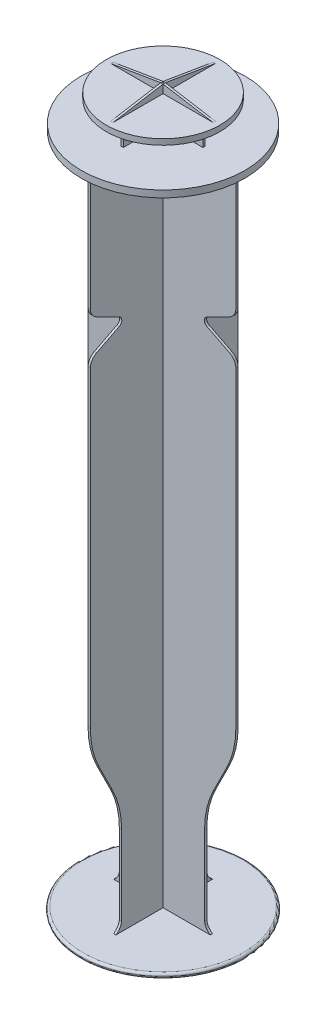
from build123d import *

# Parameters (mm, degrees)
EXTRUDE_START         = -0.2
EXTRUDE_1_OUTLINE_W   = 0.4
EXTRUDE_1_OUTLINE_H   = 3.7
EXTRUDE_1_DEPTH       = 0.4
EXTRUDE_START_2       = -7.2
EXTRUDE_1_2_OUTLINE_W = 0.4
EXTRUDE_1_2_OUTLINE_H = 3.7
EXTRUDE_1_2_DEPTH     = 7
EXTRUDE_START_3       = 119
EXTRUDE_1_3_OUTLINE_R = 14.4
EXTRUDE_1_3_DEPTH     = 1.2
EXTRUDE_1_4_OUTLINE_R = 14.5
EXTRUDE_1_4_DEPTH     = 0.85
EXTRUDE_START_4       = 123.9
EXTRUDE_1_5_OUTLINE_R = 10
EXTRUDE_1_5_DEPTH     = 1
EXTRUDE_1_6_DEPTH     = 0.4
CUT_EXTRUDE_1_DEPTH   = 129.075368436
CUT_EXTRUDE_2_DEPTH   = 129.075368436
DRAFT_1_ANGLE         = 63.434948823
DRAFT_2_ANGLE         = 63.434948823
RIB_1_REACH           = 130.053
SKETCH_4_WALL_W       = 267.026519706
SKETCH_4_WALL_H       = 0.4
RIB_2_REACH           = 130.053
SKETCH_5_WALL_W       = 267.026519706
SKETCH_5_WALL_H       = 0.4
RIB_3_REACH           = 130.053
SKETCH_6_WALL_W       = 267.026519706
SKETCH_6_WALL_H       = 0.4
RIB_4_REACH           = 130.053
SKETCH_7_WALL_W       = 261.805134662
SKETCH_7_WALL_H       = 0.4
RIB_5_REACH           = 130.053
SKETCH_8_WALL_W       = 261.805134662
SKETCH_8_WALL_H       = 0.4
RIB_6_REACH           = 130.053
SKETCH_9_WALL_W       = 261.805134662
SKETCH_9_WALL_H       = 0.4
RIB_START             = -0.2
RIB_7_DEPTH           = 0.4
RIB_8_DEPTH           = 0.4
FILLET_1_R            = 0.4
FILLET_2_R            = 2
FILLET_3_R            = 15


with BuildPart() as part:
    # 凸台-拉伸1: read off the stored shape, not the designer's step
    # 凸台-拉伸1 outline → 凸台-拉伸1 (new body)
    with BuildSketch(Plane.XY.offset(EXTRUDE_START)):
        Polygon((0, 126.4), (-0.2, 126.366666667), (-0.2, 124.9), (9, 124.9), (0.2, 126.366666667), align=None)
        with BuildLine():
            Line((13, 31), (13, 119))
            Line((13, 119), (-13, 119))
            Line((-13, 119), (-13, 20))
            Line((-13, 20), (-7.5, 20))
            Line((-7.5, 20), (-7.5, 2.391335203))
            ThreePointArc((-7.5, 2.391335203), (-7.838080215, 1.515615965), (-8.5, 0.85))
            Line((-8.5, 0.85), (8.5, 0.85))
            ThreePointArc((8.5, 0.85), (7.838080215, 1.515615965), (7.5, 2.391335203))
            Line((7.5, 2.391335203), (7.5, 31))
            Line((7.5, 31), (13, 31))
        make_face()
        with Locations((0, 122.05)):
            Rectangle(EXTRUDE_1_OUTLINE_W, EXTRUDE_1_OUTLINE_H)
    extrude(amount=EXTRUDE_1_DEPTH)

    # Extrude 1 2 outline → Extrude 1 2 (add)
    with BuildSketch(Plane.XY.offset(EXTRUDE_START_2)):
        with Locations((0, 122.05)):
            Rectangle(EXTRUDE_1_2_OUTLINE_W, EXTRUDE_1_2_OUTLINE_H)
    extrude(amount=EXTRUDE_1_2_DEPTH)

    # Extrude 1 3 outline → Extrude 1 3 (add)
    with BuildSketch(Plane(origin=(0, 0, 0), x_dir=(1, 0, 0), z_dir=(0, 1, 0)).offset(EXTRUDE_START_3)):
        Circle(EXTRUDE_1_3_OUTLINE_R)
    extrude(amount=EXTRUDE_1_3_DEPTH)

    # Extrude 1 4 outline → Extrude 1 4 (add)
    with BuildSketch(Plane(origin=(0, 0, 0), x_dir=(1, 0, 0), z_dir=(0, 1, 0))):
        Circle(EXTRUDE_1_4_OUTLINE_R)
    extrude(amount=EXTRUDE_1_4_DEPTH)

    # Extrude 1 5 outline → Extrude 1 5 (add)
    with BuildSketch(Plane(origin=(0, 0, 0), x_dir=(1, 0, 0), z_dir=(0, 1, 0)).offset(EXTRUDE_START_4)):
        Circle(EXTRUDE_1_5_OUTLINE_R)
    extrude(amount=EXTRUDE_1_5_DEPTH)

    # Extrude 1 6 outline → Extrude 1 6 (add)
    with BuildSketch(Plane.YZ.offset(EXTRUDE_START)):
        Polygon((126.366666667, -0.2), (126.4, 0), (126.366666667, 0.2), align=None)
    extrude(amount=EXTRUDE_1_6_DEPTH)

    # 草图2 → 切除-拉伸1 (cut, through all)
    with BuildSketch(Plane(origin=(0, 0, -0.2), x_dir=(-1, 0, 0), z_dir=(0, 0, -1))):
        with BuildLine():
            Line((-13, 90.7), (-7.905050667, 93.286666585))
            ThreePointArc((-7.905050667, 93.286666585), (-7.467204555, 94), (-7.905050667, 94.713333415))
            Line((-7.905050667, 94.713333415), (-13, 97.3))
            Line((-13, 97.3), (-13, 90.7))
        make_face()
    extrude(amount=-CUT_EXTRUDE_1_DEPTH, mode=Mode.SUBTRACT)

    # 草图3 → 切除-拉伸2 (cut, through all)
    with BuildSketch(Plane(origin=(0, 0, -0.2), x_dir=(-1, 0, 0), z_dir=(0, 0, -1))):
        with BuildLine():
            Line((13, 97.3), (7.905050667, 94.713333415))
            ThreePointArc((7.905050667, 94.713333415), (7.467204555, 94), (7.905050667, 93.286666585))
            Line((7.905050667, 93.286666585), (13, 90.7))
            Line((13, 90.7), (13, 97.3))
        make_face()
    extrude(amount=-CUT_EXTRUDE_2_DEPTH, mode=Mode.SUBTRACT)

    # 拔模1
    draft_1_faces = [part.faces().sort_by_distance(p)[0] for p in [
        (-10.25, 20, 0),
    ]]
    draft(draft_1_faces, Plane(origin=(-7.5, 0, -0.2), x_dir=(0, 0, -1), z_dir=(-1, 0, 0)), DRAFT_1_ANGLE)

    # 拔模2
    draft_2_faces = [part.faces().sort_by_distance(p)[0] for p in [
        (10.25, 31, 0),
    ]]
    draft(draft_2_faces, Plane(origin=(13, 0, 0.2), x_dir=(0, 0, 1), z_dir=(1, 0, 0)), DRAFT_2_ANGLE)

    # 草图4 wall → 筋1 (add, up to next)
    with BuildSketch(Plane(origin=(0, 125.633333334, 4.6), x_dir=(0, -0.164398987342, 0.986393923826), z_dir=(0, -0.986393923826, -0.164398987342)), mode=Mode.PRIVATE) as rib_1_sk1:
        Rectangle(SKETCH_4_WALL_W, SKETCH_4_WALL_H)
    rib_1_tool1 = extrude(rib_1_sk1.sketch, amount=RIB_1_REACH, mode=Mode.PRIVATE) - part.part
    add(rib_1_tool1.solids().sort_by_distance((0, 125.633333334, 4.6))[0])

    # 草图5 wall → 筋2 (add, up to next)
    with BuildSketch(Plane(origin=(-4.6, 125.633333334, 0), x_dir=(0.986393923826, 0.164398987342, 0), z_dir=(0.164398987342, -0.986393923826, 0)), mode=Mode.PRIVATE) as rib_2_sk1:
        Rectangle(SKETCH_5_WALL_W, SKETCH_5_WALL_H)
    rib_2_tool1 = extrude(rib_2_sk1.sketch, amount=RIB_2_REACH, mode=Mode.PRIVATE) - part.part
    add(rib_2_tool1.solids().sort_by_distance((-4.6, 125.633333334, 0))[0])

    # 草图6 wall → 筋3 (add, up to next)
    with BuildSketch(Plane(origin=(0, 125.633333334, -4.6), x_dir=(0, 0.164398987342, 0.986393923826), z_dir=(0, -0.986393923826, 0.164398987342)), mode=Mode.PRIVATE) as rib_3_sk1:
        Rectangle(SKETCH_6_WALL_W, SKETCH_6_WALL_H)
    rib_3_tool1 = extrude(rib_3_sk1.sketch, amount=RIB_3_REACH, mode=Mode.PRIVATE) - part.part
    add(rib_3_tool1.solids().sort_by_distance((0, 125.633333334, -4.6))[0])

    # 草图7 wall → 筋4 (add, up to next)
    with BuildSketch(Plane(origin=(-7.2, 122.05, 0), x_dir=(0, -1, 0), z_dir=(1, 0, 0)), mode=Mode.PRIVATE) as rib_4_sk1:
        Rectangle(SKETCH_7_WALL_W, SKETCH_7_WALL_H)
    rib_4_tool1 = extrude(rib_4_sk1.sketch, amount=RIB_4_REACH, mode=Mode.PRIVATE) - part.part
    add(rib_4_tool1.solids().sort_by_distance((-7.2, 122.05, 0))[0])

    # 草图8 wall → 筋5 (add, up to next)
    with BuildSketch(Plane(origin=(0, 122.05, 7.2), x_dir=(0, -1, 0), z_dir=(0, 0, -1)), mode=Mode.PRIVATE) as rib_5_sk1:
        Rectangle(SKETCH_8_WALL_W, SKETCH_8_WALL_H)
    rib_5_tool1 = extrude(rib_5_sk1.sketch, amount=RIB_5_REACH, mode=Mode.PRIVATE) - part.part
    add(rib_5_tool1.solids().sort_by_distance((0, 122.05, 7.2))[0])

    # 草图9 wall → 筋6 (add, up to next)
    with BuildSketch(Plane(origin=(7.2, 122.05, 0), x_dir=(0, -1, 0), z_dir=(-1, 0, 0)), mode=Mode.PRIVATE) as rib_6_sk1:
        Rectangle(SKETCH_9_WALL_W, SKETCH_9_WALL_H)
    rib_6_tool1 = extrude(rib_6_sk1.sketch, amount=RIB_6_REACH, mode=Mode.PRIVATE) - part.part
    add(rib_6_tool1.solids().sort_by_distance((7.2, 122.05, 0))[0])

    # 筋7: read off the stored shape, not the designer's step
    # 筋7 outline → 筋7 (add)
    with BuildSketch(Plane(origin=(0, 0, 0), x_dir=(0, 0, -1), z_dir=(1, 0, 0)).offset(RIB_START)):
        with BuildLine():
            Line((7.905050667, 94.713333415), (13, 97.3))
            Line((13, 97.3), (13, 119))
            Line((13, 119), (0.2, 119))
            Line((0.2, 119), (0.2, 0.85))
            Line((0.2, 0.85), (8.5, 0.85))
            ThreePointArc((8.5, 0.85), (7.838080215, 1.515615965), (7.5, 2.391335203))
            Line((7.5, 2.391335203), (7.5, 20))
            Line((7.5, 20), (13, 31))
            Line((13, 31), (13, 90.7))
            Line((13, 90.7), (7.905050667, 93.286666585))
            ThreePointArc((7.905050667, 93.286666585), (7.467204555, 94), (7.905050667, 94.713333415))
        make_face()
    extrude(amount=RIB_7_DEPTH)

    # 筋8: read off the stored shape, not the designer's step
    # 筋8 outline → 筋8 (add)
    with BuildSketch(Plane(origin=(0, 0, 0), x_dir=(0, -1, 0), z_dir=(-1, 0, 0)).offset(RIB_START)):
        with BuildLine():
            Line((-94.713333415, 7.905050667), (-97.3, 13))
            Line((-97.3, 13), (-119, 13))
            Line((-119, 13), (-119, 0.2))
            Line((-119, 0.2), (-0.85, 0.2))
            Line((-0.85, 0.2), (-0.85, 8.5))
            ThreePointArc((-0.85, 8.5), (-1.515615965, 7.838080215), (-2.391335203, 7.5))
            Line((-2.391335203, 7.5), (-20, 7.5))
            Line((-20, 7.5), (-31, 13))
            Line((-31, 13), (-90.7, 13))
            Line((-90.7, 13), (-93.286666585, 7.905050667))
            ThreePointArc((-93.286666585, 7.905050667), (-94, 7.467204555), (-94.713333415, 7.905050667))
        make_face()
    extrude(amount=RIB_8_DEPTH)

    # 圆角1
    fillet_1_edges = [part.edges().sort_by_distance(p)[0] for p in [
        (-14.5, 0, 0),
        (-14.5, 0.85, 0),
    ]]
    fillet(fillet_1_edges, radius=FILLET_1_R)

    # 圆角2
    fillet_2_edges = [part.edges().sort_by_distance(p)[0] for p in [
        (13, 90.7, 0),
        (13, 97.3, 0),
        (-13, 97.3, 0),
        (-13, 90.7, 0),
        (0, 90.7, -13),
        (0, 97.3, -13),
        (0, 90.7, 13),
        (0, 97.3, 13),
    ]]
    fillet(fillet_2_edges, radius=FILLET_2_R)

    # 圆角3
    fillet_3_edges = [part.edges().sort_by_distance(p)[0] for p in [
        (-13, 31, 0),
        (-7.5, 20, 0),
        (7.5, 20, 0),
        (13, 31, 0),
        (0, 20, -7.5),
        (0, 31, -13),
        (0, 20, 7.5),
        (0, 31, 13),
    ]]
    fillet(fillet_3_edges, radius=FILLET_3_R)


solid = part.part
